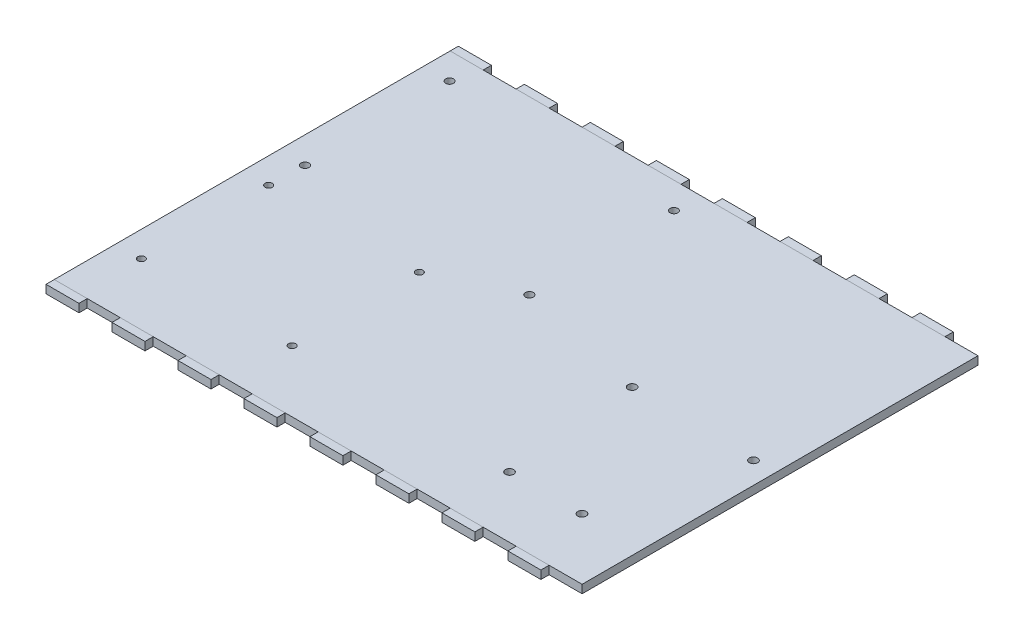
from build123d import *

# Parameters (mm, degrees)
SKETCH1_W               = 203.2
SKETCH1_H               = 152.4
BOSS_EXTRUDE1_DEPTH     = 3.175
SKETCH2_W               = 12.7
SKETCH2_H               = 3.175
BOSS_EXTRUDE2_DEPTH     = 3.175
BOSS_EXTRUDE2_2_DEPTH   = 3.175
BOSS_EXTRUDE2_3_DEPTH   = 3.175
BOSS_EXTRUDE2_4_DEPTH   = 3.175
BOSS_EXTRUDE2_5_DEPTH   = 3.175
BOSS_EXTRUDE2_6_DEPTH   = 3.175
BOSS_EXTRUDE2_7_DEPTH   = 3.175
BOSS_EXTRUDE2_8_DEPTH   = 3.175
BOSS_EXTRUDE2_9_DEPTH   = 3.175
BOSS_EXTRUDE2_10_DEPTH  = 3.175
BOSS_EXTRUDE2_11_DEPTH  = 3.175
BOSS_EXTRUDE2_12_DEPTH  = 3.175
BOSS_EXTRUDE2_13_DEPTH  = 3.175
BOSS_EXTRUDE2_14_DEPTH  = 3.175
BOSS_EXTRUDE2_15_DEPTH  = 3.175
BOSS_EXTRUDE2_16_DEPTH  = 3.175
SKETCH4_R               = 1.375
CUT_EXTRUDE1_DEPTH      = 294.475183832
SKETCH5_R               = 1.6
CUT_EXTRUDE2_DEPTH      = 317.962250237
CUT_EXTRUDE3_DEPTH      = 181.542007906
CUT_EXTRUDE3_DEPTH_BACK = 181.542007906
SKETCH10_R              = 1.535
SKETCH10_R_2            = 1.5


with BuildPart() as part:
    # Sketch1 → Boss-Extrude1 (new body)
    with BuildSketch(Plane(origin=(0, 0, 0), x_dir=(1, 0, 0), z_dir=(0, 1, 0))):
        with Locations((101.6, 76.2)):
            Rectangle(SKETCH1_W, SKETCH1_H)
    extrude(amount=BOSS_EXTRUDE1_DEPTH)

    # Sketch4 → Cut-Extrude1 (cut, through all)
    with BuildSketch(Plane(origin=(-65.618517222, 3.175, -114.528898402), x_dir=(1, 0, 0), z_dir=(0, 1, 0))):
        with Locations((75.468517222, -41.828898402)):
            Circle(SKETCH4_R)
        with Locations((75.468517222, -90.828898402)):
            Circle(SKETCH4_R)
        with Locations((133.468517222, -90.828898402)):
            Circle(SKETCH4_R)
        with Locations((133.468517222, -41.828898402)):
            Circle(SKETCH4_R)
    extrude(amount=-CUT_EXTRUDE1_DEPTH, mode=Mode.SUBTRACT)

    # Sketch5 → Cut-Extrude2 (cut, through all)
    with BuildSketch(Plane(origin=(-58.332709996, 3.175, -175.865858612), x_dir=(0, 0, 1), z_dir=(0, 1, 0))):
        with Locations((100.475405858, 205.398928035)):
            Circle(SKETCH5_R)
        with Locations((101.575405858, 253.198928035)):
            Circle(SKETCH5_R)
        with Locations((152.375405858, 210.098928035)):
            Circle(SKETCH5_R)
        with Locations((152.375405858, 237.998928035)):
            Circle(SKETCH5_R)
    extrude(amount=-CUT_EXTRUDE2_DEPTH, mode=Mode.SUBTRACT)

    # Sketch10 → Cut-Extrude3 (cut, two sides: drawn at the far end of the back side and taken through both)
    with BuildSketch(Plane(origin=(154.738240667, 3.175, -89.784200023), x_dir=(0, 0, -1), z_dir=(0, 1, 0)).offset(-CUT_EXTRUDE3_DEPTH_BACK)):
        with Locations((-3.423776116, 144.568240667)):
            Circle(SKETCH10_R)
        with Locations((52.455799977, 144.785900219)):
            Circle(SKETCH10_R_2)
        with Locations((-3.423776116, 58.208240667)):
            Circle(SKETCH10_R)
        with Locations((52.455799977, 58.425900219)):
            Circle(SKETCH10_R_2)
    extrude(amount=CUT_EXTRUDE3_DEPTH + CUT_EXTRUDE3_DEPTH_BACK, mode=Mode.SUBTRACT)


with BuildPart() as body_2:
    # Sketch2 → Boss-Extrude2 (new body)
    with BuildSketch(Plane(origin=(0, 3.175, 0), x_dir=(1, 0, 0), z_dir=(0, 1, 0))):
        with Locations((31.75, -1.5875)):
            Rectangle(SKETCH2_W, SKETCH2_H)
    extrude(amount=-BOSS_EXTRUDE2_DEPTH)


with BuildPart() as body_3:
    # Sketch2 → Boss-Extrude2 2 (new body)
    with BuildSketch(Plane(origin=(0, 3.175, 0), x_dir=(1, 0, 0), z_dir=(0, 1, 0))):
        with Locations((6.35, -1.5875)):
            Rectangle(SKETCH2_W, SKETCH2_H)
    extrude(amount=-BOSS_EXTRUDE2_2_DEPTH)


with BuildPart() as body_4:
    # Sketch2 → Boss-Extrude2 3 (new body)
    with BuildSketch(Plane(origin=(0, 3.175, 0), x_dir=(1, 0, 0), z_dir=(0, 1, 0))):
        with Locations((57.15, -1.5875)):
            Rectangle(SKETCH2_W, SKETCH2_H)
    extrude(amount=-BOSS_EXTRUDE2_3_DEPTH)


with BuildPart() as body_5:
    # Sketch2 → Boss-Extrude2 4 (new body)
    with BuildSketch(Plane(origin=(0, 3.175, 0), x_dir=(1, 0, 0), z_dir=(0, 1, 0))):
        with Locations((82.55, -1.5875)):
            Rectangle(SKETCH2_W, SKETCH2_H)
    extrude(amount=-BOSS_EXTRUDE2_4_DEPTH)


with BuildPart() as body_6:
    # Sketch2 → Boss-Extrude2 5 (new body)
    with BuildSketch(Plane(origin=(0, 3.175, 0), x_dir=(1, 0, 0), z_dir=(0, 1, 0))):
        with Locations((107.95, -1.5875)):
            Rectangle(SKETCH2_W, SKETCH2_H)
    extrude(amount=-BOSS_EXTRUDE2_5_DEPTH)


with BuildPart() as body_7:
    # Sketch2 → Boss-Extrude2 6 (new body)
    with BuildSketch(Plane(origin=(0, 3.175, 0), x_dir=(1, 0, 0), z_dir=(0, 1, 0))):
        with Locations((133.35, -1.5875)):
            Rectangle(SKETCH2_W, SKETCH2_H)
    extrude(amount=-BOSS_EXTRUDE2_6_DEPTH)


with BuildPart() as body_8:
    # Sketch2 → Boss-Extrude2 7 (new body)
    with BuildSketch(Plane(origin=(0, 3.175, 0), x_dir=(1, 0, 0), z_dir=(0, 1, 0))):
        with Locations((158.75, -1.5875)):
            Rectangle(SKETCH2_W, SKETCH2_H)
    extrude(amount=-BOSS_EXTRUDE2_7_DEPTH)


with BuildPart() as body_9:
    # Sketch2 → Boss-Extrude2 8 (new body)
    with BuildSketch(Plane(origin=(0, 3.175, 0), x_dir=(1, 0, 0), z_dir=(0, 1, 0))):
        with Locations((184.15, -1.5875)):
            Rectangle(SKETCH2_W, SKETCH2_H)
    extrude(amount=-BOSS_EXTRUDE2_8_DEPTH)


with BuildPart() as body_10:
    # Sketch2 → Boss-Extrude2 9 (new body)
    with BuildSketch(Plane(origin=(0, 3.175, 0), x_dir=(1, 0, 0), z_dir=(0, 1, 0))):
        with Locations((184.15, 153.9875)):
            Rectangle(SKETCH2_W, SKETCH2_H)
    extrude(amount=-BOSS_EXTRUDE2_9_DEPTH)


with BuildPart() as body_11:
    # Sketch2 → Boss-Extrude2 10 (new body)
    with BuildSketch(Plane(origin=(0, 3.175, 0), x_dir=(1, 0, 0), z_dir=(0, 1, 0))):
        with Locations((158.75, 153.9875)):
            Rectangle(SKETCH2_W, SKETCH2_H)
    extrude(amount=-BOSS_EXTRUDE2_10_DEPTH)


with BuildPart() as body_12:
    # Sketch2 → Boss-Extrude2 11 (new body)
    with BuildSketch(Plane(origin=(0, 3.175, 0), x_dir=(1, 0, 0), z_dir=(0, 1, 0))):
        with Locations((133.35, 153.9875)):
            Rectangle(SKETCH2_W, SKETCH2_H)
    extrude(amount=-BOSS_EXTRUDE2_11_DEPTH)


with BuildPart() as body_13:
    # Sketch2 → Boss-Extrude2 12 (new body)
    with BuildSketch(Plane(origin=(0, 3.175, 0), x_dir=(1, 0, 0), z_dir=(0, 1, 0))):
        with Locations((107.95, 153.9875)):
            Rectangle(SKETCH2_W, SKETCH2_H)
    extrude(amount=-BOSS_EXTRUDE2_12_DEPTH)


with BuildPart() as body_14:
    # Sketch2 → Boss-Extrude2 13 (new body)
    with BuildSketch(Plane(origin=(0, 3.175, 0), x_dir=(1, 0, 0), z_dir=(0, 1, 0))):
        with Locations((82.55, 153.9875)):
            Rectangle(SKETCH2_W, SKETCH2_H)
    extrude(amount=-BOSS_EXTRUDE2_13_DEPTH)


with BuildPart() as body_15:
    # Sketch2 → Boss-Extrude2 14 (new body)
    with BuildSketch(Plane(origin=(0, 3.175, 0), x_dir=(1, 0, 0), z_dir=(0, 1, 0))):
        with Locations((57.15, 153.9875)):
            Rectangle(SKETCH2_W, SKETCH2_H)
    extrude(amount=-BOSS_EXTRUDE2_14_DEPTH)


with BuildPart() as body_16:
    # Sketch2 → Boss-Extrude2 15 (new body)
    with BuildSketch(Plane(origin=(0, 3.175, 0), x_dir=(1, 0, 0), z_dir=(0, 1, 0))):
        with Locations((31.75, 153.9875)):
            Rectangle(SKETCH2_W, SKETCH2_H)
    extrude(amount=-BOSS_EXTRUDE2_15_DEPTH)


with BuildPart() as body_17:
    # Sketch2 → Boss-Extrude2 16 (new body)
    with BuildSketch(Plane(origin=(0, 3.175, 0), x_dir=(1, 0, 0), z_dir=(0, 1, 0))):
        with Locations((6.35, 153.9875)):
            Rectangle(SKETCH2_W, SKETCH2_H)
    extrude(amount=-BOSS_EXTRUDE2_16_DEPTH)


solid = Compound([part.part, body_2.part, body_3.part, body_4.part, body_5.part, body_6.part, body_7.part, body_8.part, body_9.part, body_10.part, body_11.part, body_12.part, body_13.part, body_14.part, body_15.part, body_16.part, body_17.part])
